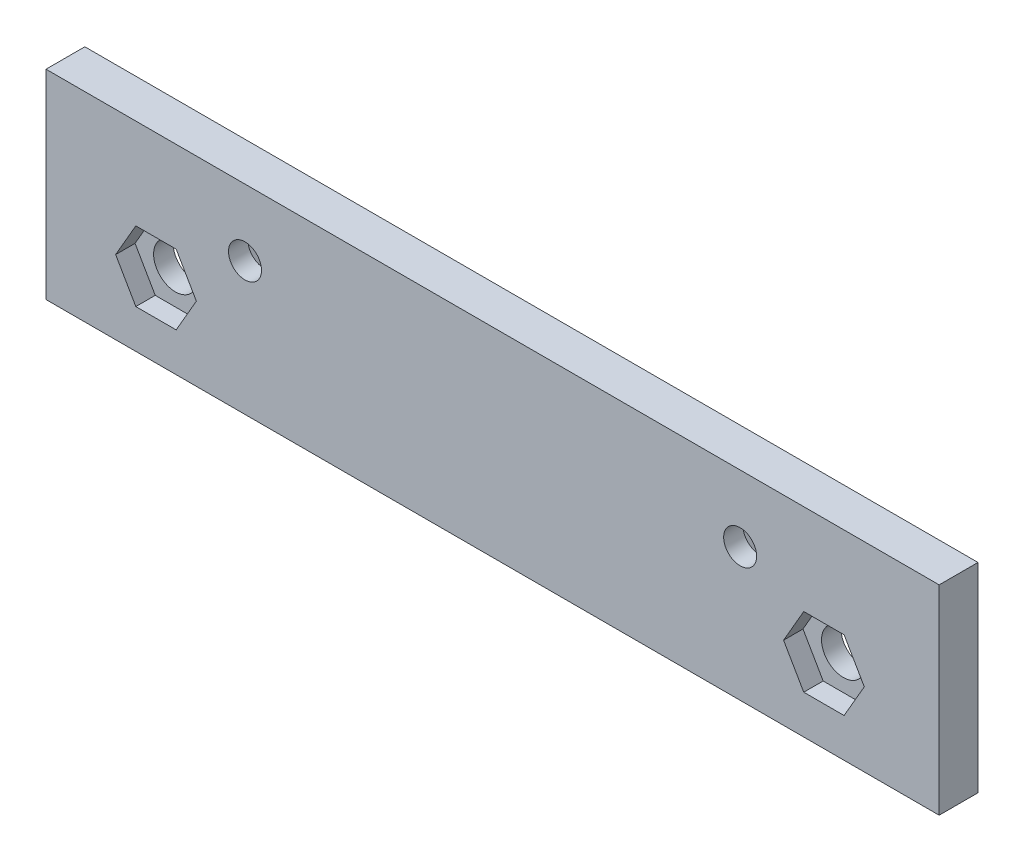
from build123d import *

# Parameters (mm, degrees)
SKETCH1_W            = 92
SKETCH1_H            = 75
BOSS_EXTRUDE1_DEPTH  = 4
M4_CLEARANCE_HOLE1_D = 4.5
M3_CLEARANCE_HOLE1_D = 3.4
CUT_EXTRUDE1_DEPTH   = 2
CUT_EXTRUDE2_DEPTH   = 2
SKETCH10_W           = 92
SKETCH10_H           = 26.15
SKETCH10_H_2         = 28.3
CUT_EXTRUDE3_DEPTH   = 4


with BuildPart() as part:
    # Sketch1 → Boss-Extrude1 (new body)
    with BuildSketch(Plane.XY):
        Rectangle(SKETCH1_W, SKETCH1_H)
    extrude(amount=BOSS_EXTRUDE1_DEPTH)

    # M4 Clearance Hole1 (through all)
    with Locations(Plane.XY.offset(4)):
        with Locations((-34.669877487, -1.6), (34.130122513, -1.6)):
            Hole(M4_CLEARANCE_HOLE1_D / 2)

    # M3 Clearance Hole1 (through all)
    with Locations(Plane.XY.offset(4)):
        with Locations((-25.5, 4.5), (25.5, 4.5)):
            Hole(M3_CLEARANCE_HOLE1_D / 2)

    # Sketch8 → Cut-Extrude1 (cut)
    with BuildSketch(Plane.XY.offset(4)):
        Polygon((-30.512955548, -1.6), (-32.591416518, 2), (-36.748338456, 2), (-38.826799425, -1.6), (-36.748338456, -5.2), (-32.591416518, -5.2), align=None)
        Polygon((29.973200575, -1.6), (32.051661544, -5.2), (36.208583482, -5.2), (38.287044452, -1.6), (36.208583482, 2), (32.051661544, 2), align=None)
    extrude(amount=-CUT_EXTRUDE1_DEPTH, mode=Mode.SUBTRACT)

    # Sketch9 → Cut-Extrude2 (cut)
    with BuildSketch(Plane(origin=(0, 0, 0), x_dir=(-1, 0, 0), z_dir=(0, 0, -1))):
        Polygon((-22.209103466, 4.5), (-23.854551733, 7.35), (-27.145448267, 7.35), (-28.790896534, 4.5), (-27.145448267, 1.65), (-23.854551733, 1.65), align=None)
        Polygon((22.209103466, 4.5), (23.854551733, 1.65), (27.145448267, 1.65), (28.790896534, 4.5), (27.145448267, 7.35), (23.854551733, 7.35), align=None)
    extrude(amount=-CUT_EXTRUDE2_DEPTH, mode=Mode.SUBTRACT)

    # Sketch10 → Cut-Extrude3 (cut)
    with BuildSketch(Plane(origin=(0, 0, 0), x_dir=(-1, 0, 0), z_dir=(0, 0, -1))):
        with Locations((0, 24.425)):
            Rectangle(SKETCH10_W, SKETCH10_H)
        with Locations((0, -23.35)):
            Rectangle(SKETCH10_W, SKETCH10_H_2)
    extrude(amount=-CUT_EXTRUDE3_DEPTH, mode=Mode.SUBTRACT)


solid = part.part
